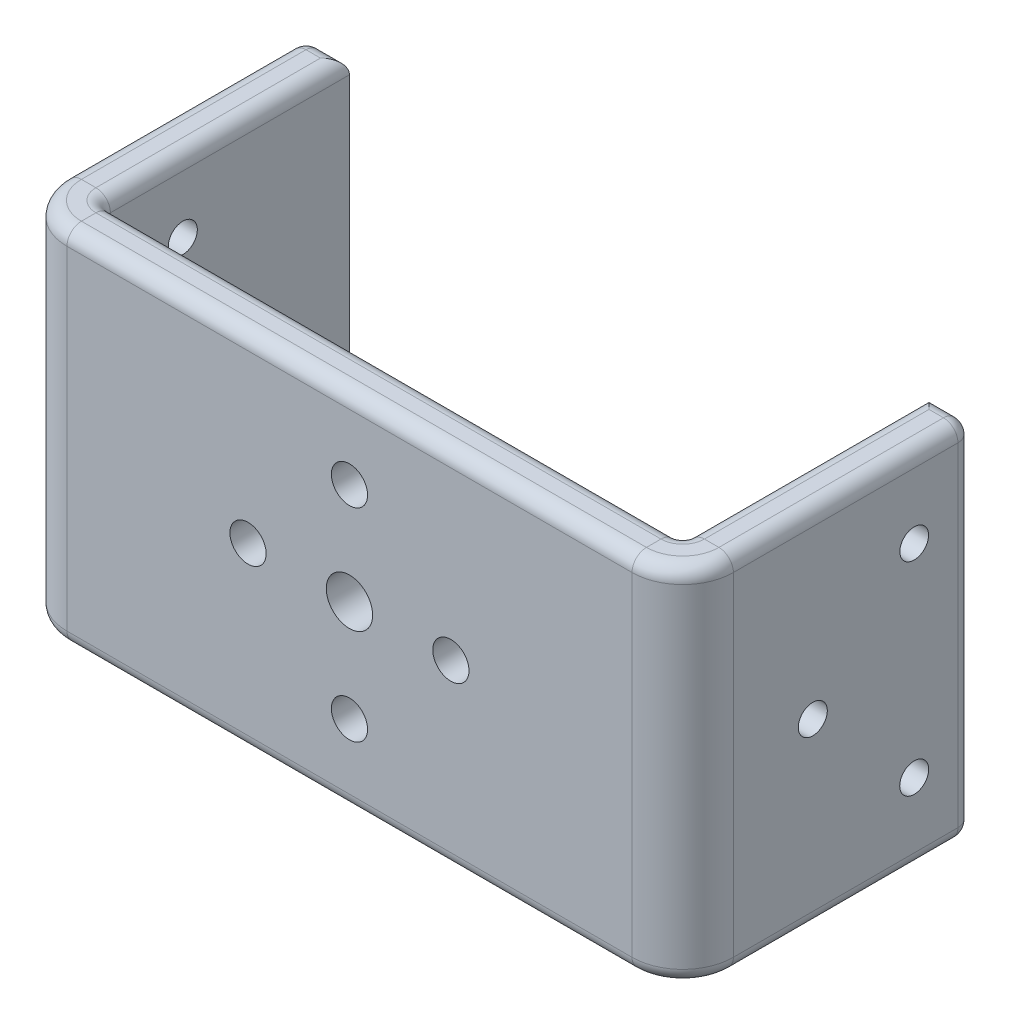
from build123d import *

# Parameters (mm, degrees)
SKETCH1_W                    = 40
SKETCH1_H                    = 25
BASE_FLANGE1_DEPTH           = 3
EDGE_FLANGE1_STRIP_W         = 13
EDGE_FLANGE1_STRIP_H         = 3
EDGE_FLANGE1_STRIP_CUT_DEPTH = 25
EDGE_FLANGE1_DEPTH           = 25
EDGE_FLANGE2_STRIP_W         = 13
EDGE_FLANGE2_STRIP_H         = 3
EDGE_FLANGE2_STRIP_CUT_DEPTH = 25
EDGE_FLANGE2_DEPTH           = 25
CUT_EXTRUDE1_DEPTH           = 7
CUT_EXTRUDE2_DEPTH           = 6
FILLET1_R                    = 1
FILLET2_R                    = 1
CUT_EXTRUDE3_DEPTH           = 14


# Sheet-metal steps are written as plain solids
with BuildPart() as part:
    # Sketch1 → Base-Flange1 (new body)
    with BuildSketch(Plane.XY):
        Rectangle(SKETCH1_W, SKETCH1_H)
    extrude(amount=-BASE_FLANGE1_DEPTH)

    # Edge-Flange1 strip (across the edge) → Edge-Flange1 strip cut (cut)
    with BuildSketch(Plane(origin=(20, 12.5, -3), x_dir=(-1, 0, 0), z_dir=(0, -1, 0))):
        with Locations((-6, -1.5)):
            Rectangle(EDGE_FLANGE1_STRIP_W, EDGE_FLANGE1_STRIP_H)
    extrude(amount=EDGE_FLANGE1_STRIP_CUT_DEPTH, mode=Mode.SUBTRACT)

    # Edge-Flange1 section (across the edge) → Edge-Flange1 (add)
    with BuildSketch(Plane(origin=(20, 12.5, -3), x_dir=(-1, 0, 0), z_dir=(0, -1, 0))):
        with BuildLine():
            Line((-3, 0.5), (-3, 17))
            Line((-3, 17), (0, 17))
            Line((0, 17), (0, 0.5))
            ThreePointArc((0, 0.5), (0.146446609, 0.146446609), (0.5, 0))
            Line((0.5, 0), (0.5, -3))
            ThreePointArc((0.5, -3), (-1.974873734, -1.974873734), (-3, 0.5))
        make_face()
    extrude(amount=EDGE_FLANGE1_DEPTH)

    # Edge-Flange2 strip (across the edge) → Edge-Flange2 strip cut (cut)
    with BuildSketch(Plane(origin=(-20, -12.5, -3), x_dir=(1, 0, 0), z_dir=(0, 1, 0))):
        with Locations((-6, -1.5)):
            Rectangle(EDGE_FLANGE2_STRIP_W, EDGE_FLANGE2_STRIP_H)
    extrude(amount=EDGE_FLANGE2_STRIP_CUT_DEPTH, mode=Mode.SUBTRACT)

    # Edge-Flange2 section (across the edge) → Edge-Flange2 (add)
    with BuildSketch(Plane(origin=(-20, -12.5, -3), x_dir=(1, 0, 0), z_dir=(0, 1, 0))):
        with BuildLine():
            Line((-3, 0.5), (-3, 17))
            Line((-3, 17), (0, 17))
            Line((0, 17), (0, 0.5))
            ThreePointArc((0, 0.5), (0.146446609, 0.146446609), (0.5, 0))
            Line((0.5, 0), (0.5, -3))
            ThreePointArc((0.5, -3), (-1.974873734, -1.974873734), (-3, 0.5))
        make_face()
    extrude(amount=EDGE_FLANGE2_DEPTH)

    # Sketch12 → Cut-Extrude1 (cut)
    with BuildSketch(Plane(origin=(-20, 10.212212675, -95), x_dir=(0, -1, 0), z_dir=(-1, 0, 0))):
        with BuildLine():
            ThreePointArc((17.712212658, 87.5), (16.712212675, 86.499999984), (17.712212691, 85.5))
            ThreePointArc((17.712212691, 85.5), (18.712212675, 86.500000016), (17.712212658, 87.5))
        make_face()
        with BuildLine():
            ThreePointArc((2.712212658, 87.5), (1.712212675, 86.499999984), (2.712212691, 85.5))
            ThreePointArc((2.712212691, 85.5), (3.712212675, 86.500000016), (2.712212658, 87.5))
        make_face()
    extrude(amount=CUT_EXTRUDE1_DEPTH, mode=Mode.SUBTRACT)

    # Sketch13 → Cut-Extrude2 (cut)
    with BuildSketch(Plane(origin=(20, 10.212212675, -95), x_dir=(0, 1, 0), z_dir=(1, 0, 0))):
        with BuildLine():
            ThreePointArc((-3.21221269, 80.01), (-4.202212675, 79.019999984), (-3.212212659, 78.03))
            ThreePointArc((-3.212212659, 78.03), (-2.222212675, 79.020000016), (-3.21221269, 80.01))
        make_face()
        with BuildLine():
            ThreePointArc((-17.212212691, 80.02), (-18.212212675, 79.019999984), (-17.212212658, 78.02))
            ThreePointArc((-17.212212658, 78.02), (-16.212212675, 79.020000016), (-17.212212691, 80.02))
        make_face()
        with BuildLine():
            ThreePointArc((-10.212212691, 87.02), (-11.212212675, 86.019999984), (-10.212212658, 85.02))
            ThreePointArc((-10.212212658, 85.02), (-9.212212675, 86.020000016), (-10.212212691, 87.02))
        make_face()
    extrude(amount=CUT_EXTRUDE2_DEPTH, mode=Mode.SUBTRACT)

    # Fillet1
    fillet1_edges = [part.edges().sort_by_distance(p)[0] for p in [
        (0, 12.5, 0),
        (21.974873734, 12.5, -1.025126266),
        (21.974873734, -12.5, -1.025126266),
        (23, -12.5, -11.75),
        (23, 0, -20),
        (23, 12.5, -11.75),
        (0, -12.5, 0),
        (-21.974873734, -12.5, -1.025126266),
        (-21.974873734, 12.5, -1.025126266),
        (-23, 12.5, -11.75),
        (-23, 0, -20),
        (-23, -12.5, -11.75),
    ]]
    fillet(fillet1_edges, radius=FILLET1_R)

    # Fillet2
    # the kernel refuses this fillet: 1 mm, written as the material it takes off along each edge
    with BuildSketch(Plane(origin=(-22, 11.5, -19), x_dir=(0, 0, -1), z_dir=(0, 1, 0))) as fillet2_piece_1_section:
        Polygon((0, 0), (FILLET2_R, 0), (FILLET2_R, FILLET2_R), (0, FILLET2_R), align=None)
    fillet2_piece_1 = extrude(amount=FILLET2_R, mode=Mode.PRIVATE)
    fillet2_piece_1 = fillet2_piece_1 - Plane(origin=(-22, 11.5, -19), x_dir=(0.70710678118655, 0, 0.707106781186545), z_dir=(0, 1, 0)) * Sphere(FILLET2_R, mode=Mode.PRIVATE)
    add(fillet2_piece_1, mode=Mode.SUBTRACT)
    with BuildSketch(Plane(origin=(-22, -11.5, -19), x_dir=(0, -1, 0), z_dir=(0, 0, -1))) as fillet2_piece_2_section:
        Polygon((0, 0), (FILLET2_R, 0), (FILLET2_R, FILLET2_R), (0, FILLET2_R), align=None)
    fillet2_piece_2 = extrude(amount=FILLET2_R, mode=Mode.PRIVATE)
    fillet2_piece_2 = fillet2_piece_2 - Plane(origin=(-22, -11.5, -19), x_dir=(0.7071067811865475, 0.7071067811865477, -2.4688501310822653e-15), z_dir=(0, 0, -1)) * Sphere(FILLET2_R, mode=Mode.PRIVATE)
    add(fillet2_piece_2, mode=Mode.SUBTRACT)
    with BuildSketch(Plane(origin=(22, 11.5, -19), x_dir=(0, 0, -1), z_dir=(0, 1, 0))) as fillet2_piece_3_section:
        Polygon((0, 0), (FILLET2_R, 0), (FILLET2_R, -FILLET2_R), (0, -FILLET2_R), align=None)
    fillet2_piece_3 = extrude(amount=FILLET2_R, mode=Mode.PRIVATE)
    fillet2_piece_3 = fillet2_piece_3 - Plane(origin=(22, 11.5, -19), x_dir=(-0.70710678118655, 0, 0.707106781186545), z_dir=(0, 1, 0)) * Sphere(FILLET2_R, mode=Mode.PRIVATE)
    add(fillet2_piece_3, mode=Mode.SUBTRACT)
    with BuildSketch(Plane(origin=(22, -11.5, -19), x_dir=(0, -1, 0), z_dir=(0, 0, -1))) as fillet2_piece_4_section:
        Polygon((0, 0), (FILLET2_R, 0), (FILLET2_R, -FILLET2_R), (0, -FILLET2_R), align=None)
    fillet2_piece_4 = extrude(amount=FILLET2_R, mode=Mode.PRIVATE)
    fillet2_piece_4 = fillet2_piece_4 - Plane(origin=(22, -11.5, -19), x_dir=(-0.7071067811865475, 0.7071067811865477, -2.4688501310822653e-15), z_dir=(0, 0, -1)) * Sphere(FILLET2_R, mode=Mode.PRIVATE)
    add(fillet2_piece_4, mode=Mode.SUBTRACT)
    with BuildSketch(Plane(origin=(22, -12.5, -20), x_dir=(0, 1, 0), z_dir=(-1, 0, 0)), Plane(origin=(22, 12.5, -20), x_dir=(0, 0, 1), z_dir=(-1, 0, 0))) as fillet2_piece_5:
        with BuildLine():
            CenterArc((FILLET2_R, -FILLET2_R), FILLET2_R, 90, 90)
            Line((0, -FILLET2_R), (0, 0))
            Line((0, 0), (FILLET2_R, 0))
        make_face()
    extrude(amount=4.5, mode=Mode.SUBTRACT)
    with BuildSketch(Plane(origin=(-22, -12.5, -20), x_dir=(0, 1, 0), z_dir=(1, 0, 0)), Plane(origin=(-22, 12.5, -20), x_dir=(0, 0, 1), z_dir=(1, 0, 0))) as fillet2_piece_6:
        with BuildLine():
            CenterArc((FILLET2_R, FILLET2_R), FILLET2_R, 180, 90)
            Line((0, FILLET2_R), (0, 0))
            Line((0, 0), (FILLET2_R, 0))
        make_face()
    extrude(amount=4.5, mode=Mode.SUBTRACT)
    with BuildSketch(Plane(origin=(-19.5, 12.5, -3), x_dir=(0, 0, 1), z_dir=(1, 0, 0))) as fillet2_piece_7:
        with BuildLine():
            CenterArc((FILLET2_R, FILLET2_R), FILLET2_R, 180, 90)
            Line((0, FILLET2_R), (0, 0))
            Line((0, 0), (FILLET2_R, 0))
        make_face()
    extrude(amount=39, mode=Mode.SUBTRACT)
    with BuildSketch(Plane(origin=(19.5, 12.5, -3.5), x_dir=(1, 0, 0), z_dir=(0, 0, -1))) as fillet2_piece_8:
        with BuildLine():
            CenterArc((0.5 + FILLET2_R, FILLET2_R), FILLET2_R, 180, 90)
            Line((0.5, FILLET2_R), (0.5, 0))
            Line((0.5, 0), (0.5 + FILLET2_R, 0))
        make_face()
    revolve(axis=Axis((19.5, 12.5, -3.5), (0, -1, 0)), revolution_arc=90, mode=Mode.SUBTRACT)
    with BuildSketch(Plane(origin=(19.5, -12.5, -3.5), x_dir=(1, 0, 0), z_dir=(0, 0, -1))) as fillet2_piece_9:
        with BuildLine():
            CenterArc((0.5 + FILLET2_R, -FILLET2_R), FILLET2_R, 90, 90)
            Line((0.5 + FILLET2_R, 0), (0.5, 0))
            Line((0.5, 0), (0.5, -FILLET2_R))
        make_face()
    revolve(axis=Axis((19.5, -12.5, -3.5), (0, -1, 0)), revolution_arc=90, mode=Mode.SUBTRACT)
    with BuildSketch(Plane(origin=(20, -12.5, -22.5), x_dir=(0, 1, 0), z_dir=(0, 0, 1)), Plane(origin=(20, 12.5, -22.5), x_dir=(1, 0, 0), z_dir=(0, 0, 1))) as fillet2_piece_10:
        with BuildLine():
            CenterArc((FILLET2_R, -FILLET2_R), FILLET2_R, 90, 90)
            Line((0, -FILLET2_R), (0, 0))
            Line((0, 0), (FILLET2_R, 0))
        make_face()
    extrude(amount=19, mode=Mode.SUBTRACT)
    with BuildSketch(Plane(origin=(19.5, -12.5, -3), x_dir=(0, 1, 0), z_dir=(-1, 0, 0))) as fillet2_piece_11:
        with BuildLine():
            CenterArc((FILLET2_R, -FILLET2_R), FILLET2_R, 90, 90)
            Line((0, -FILLET2_R), (0, 0))
            Line((0, 0), (FILLET2_R, 0))
        make_face()
    extrude(amount=39, mode=Mode.SUBTRACT)
    with BuildSketch(Plane(origin=(-19.5, -12.5, -3.5), x_dir=(-1, 0, 0), z_dir=(0, 0, -1))) as fillet2_piece_12:
        with BuildLine():
            CenterArc((0.5 + FILLET2_R, FILLET2_R), FILLET2_R, 180, 90)
            Line((0.5 + FILLET2_R, 0), (0.5, 0))
            Line((0.5, 0), (0.5, FILLET2_R))
        make_face()
    revolve(axis=Axis((-19.5, -12.5, -3.5), (0, 1, 0)), revolution_arc=90, mode=Mode.SUBTRACT)
    with BuildSketch(Plane(origin=(-19.5, 12.5, -3.5), x_dir=(-1, 0, 0), z_dir=(0, 0, -1))) as fillet2_piece_13:
        with BuildLine():
            CenterArc((0.5 + FILLET2_R, -FILLET2_R), FILLET2_R, 90, 90)
            Line((0.5, -FILLET2_R), (0.5, 0))
            Line((0.5, 0), (0.5 + FILLET2_R, 0))
        make_face()
    revolve(axis=Axis((-19.5, 12.5, -3.5), (0, 1, 0)), revolution_arc=90, mode=Mode.SUBTRACT)
    with BuildSketch(Plane(origin=(-20, 12.5, -22.5), x_dir=(-1, 0, 0), z_dir=(0, 0, 1)), Plane(origin=(-20, -12.5, -22.5), x_dir=(0, 1, 0), z_dir=(0, 0, 1))) as fillet2_piece_14:
        with BuildLine():
            CenterArc((FILLET2_R, FILLET2_R), FILLET2_R, 180, 90)
            Line((0, FILLET2_R), (0, 0))
            Line((0, 0), (FILLET2_R, 0))
        make_face()
    extrude(amount=19, mode=Mode.SUBTRACT)

    # Sketch14 → Cut-Extrude3 (cut)
    with BuildSketch(Plane(origin=(1.842409503, 10.212212675, 0), x_dir=(0, 1, 0), z_dir=(0, 0, 1))):
        with BuildLine():
            ThreePointArc((-8.962212675, 8.842411376), (-10.212212675, 10.092411376), (-11.462212675, 8.842411376))
            ThreePointArc((-11.462212675, 8.842411376), (-10.212212675, 7.592411376), (-8.962212675, 8.842411376))
        make_face()
        with BuildLine():
            ThreePointArc((-3.212210801, 0.592409503), (-1.962210801, 1.842409503), (-3.212210801, 3.092409503))
            ThreePointArc((-3.212210801, 3.092409503), (-4.462210801, 1.842409503), (-3.212210801, 0.592409503))
        make_face()
        with BuildLine():
            ThreePointArc((-17.212214548, 0.592409503), (-15.962214548, 1.842409503), (-17.212214548, 3.092409503))
            ThreePointArc((-17.212214548, 3.092409503), (-18.462214548, 1.842409503), (-17.212214548, 0.592409503))
        make_face()
        with BuildLine():
            ThreePointArc((-11.462212675, -5.15759237), (-10.212212675, -6.40759237), (-8.962212675, -5.15759237))
            ThreePointArc((-8.962212675, -5.15759237), (-10.212212675, -3.90759237), (-11.462212675, -5.15759237))
        make_face()
        with BuildLine():
            ThreePointArc((-10.212212675, 0.242409503), (-8.612212675, 1.842409503), (-10.212212675, 3.442409503))
            ThreePointArc((-10.212212675, 3.442409503), (-11.812212675, 1.842409503), (-10.212212675, 0.242409503))
        make_face()
    extrude(amount=-CUT_EXTRUDE3_DEPTH, mode=Mode.SUBTRACT)


solid = part.part
